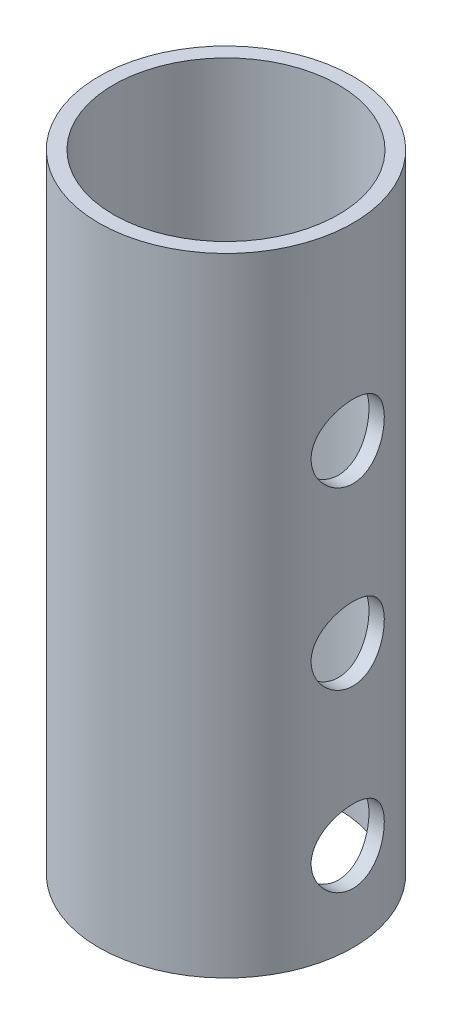
from build123d import *

# Parameters (mm, degrees)
SKETCH1_R           = 43.5
SKETCH1_R_2         = 38.5
BOSS_EXTRUDE1_DEPTH = 214.8
SKETCH2_R           = 12.53
CUT_EXTRUDE1_DEPTH  = 224.435762581
SKETCH4_R           = 7.5
CUT_EXTRUDE2_DEPTH  = 224.435762716


with BuildPart() as part:
    # Sketch1 → Boss-Extrude1 (new body)
    with BuildSketch(Plane(origin=(0, 0, 0), x_dir=(1, 0, 0), z_dir=(0, 1, 0))):
        Circle(SKETCH1_R)
        Circle(SKETCH1_R_2, mode=Mode.SUBTRACT)
    extrude(amount=BOSS_EXTRUDE1_DEPTH)

    # Sketch2 → Cut-Extrude1 (cut, through all)
    with BuildSketch(Plane(origin=(0, 0, 0), x_dir=(0, 0, -1), z_dir=(1, 0, 0))):
        with Locations((0, 150.1)):
            Circle(SKETCH2_R)
        with Locations((0, 90.1)):
            Circle(SKETCH2_R)
        with Locations((0, 30.1)):
            Circle(SKETCH2_R)
    extrude(amount=CUT_EXTRUDE1_DEPTH, mode=Mode.SUBTRACT)

    # Sketch4 → Cut-Extrude2 (cut, through all)
    with BuildSketch(Plane(origin=(0, 0, 0), x_dir=(0, 0, -1), z_dir=(1, 0, 0))):
        with Locations((0, 64.6)):
            Circle(SKETCH4_R)
    extrude(amount=-CUT_EXTRUDE2_DEPTH, mode=Mode.SUBTRACT)


solid = part.part
